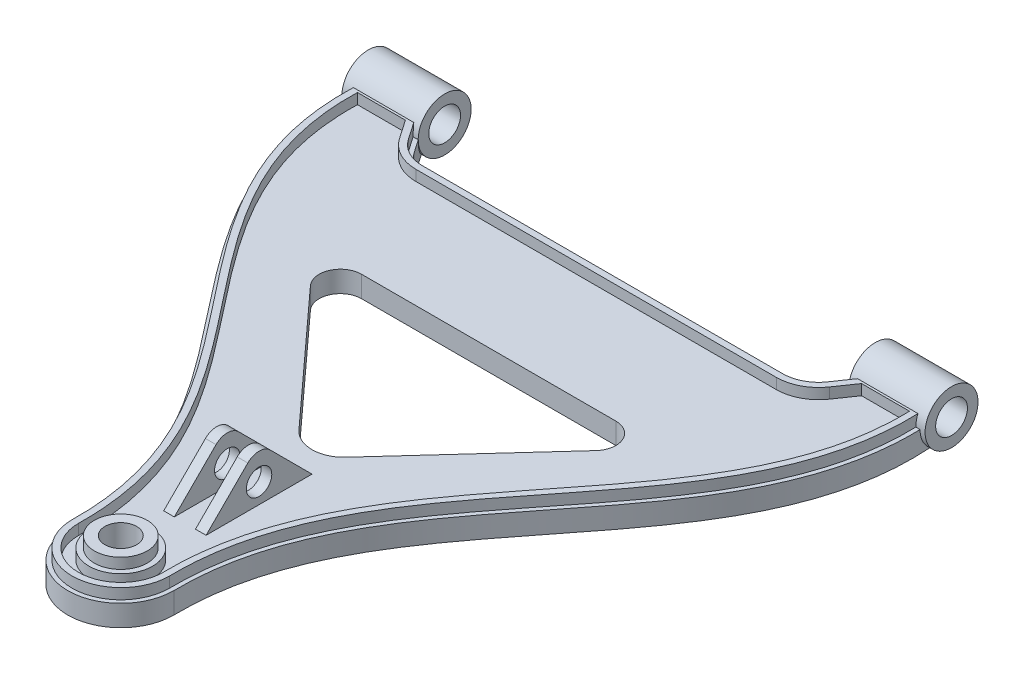
from build123d import *

# Parameters (mm, degrees)
SALIENTE_EXTRUIR1_DEPTH = 5
CROQUIS6_R              = 6
SALIENTE_EXTRUIR2_DEPTH = 5
EXTRUIR_L_MINA1_DEPTH   = 5
CROQUIS9_R              = 12.5
CROQUIS9_R_2            = 7.5
SALIENTE_EXTRUIR3_DEPTH = 18
CROQUIS10_R             = 15
SALIENTE_EXTRUIR4_DEPTH = 5
CROQUIS10_3_R           = 12.5
SALIENTE_EXTRUIR5_DEPTH = 10
CROQUIS11_R             = 7.5
CORTAR_EXTRUIR1_DEPTH   = 20


# Read off the part's stored shape, not the designer's step: Extruir-Lámina1
with BuildPart() as part:
    # Croquis1 → Saliente-Extruir1 (new, symmetric)
    with BuildSketch(Plane(origin=(0, 0, 0), x_dir=(1, 0, 0), z_dir=(0, 1, 0))):
        with BuildLine():
            Line((-135, 131.926889983), (-105, 131.926889983))
            Line((-105, 131.926889983), (-97.355197186, 120.822380101))
            ThreePointArc((-97.355197186, 120.822380101), (-91.978989417, 116.050643627), (-85, 114.328207662))
            Line((-85, 114.328207662), (85, 114.328207662))
            ThreePointArc((85, 114.328207662), (91.978989417, 116.050643627), (97.355197186, 120.822380101))
            Line((97.355197186, 120.822380101), (105, 131.926889983))
            Line((105, 131.926889983), (135, 131.926889983))
            add(Edge.make_bspline(
                [(135, 131.926889983), (141.952707227, 30.351328575), (23.130947771, -13.752661754), (25, -115)],
                knots=[0, 0, 0, 0, 1, 1, 1, 1], degree=3))
            ThreePointArc((25, -115), (0, -140), (-25, -115))
            add(Edge.make_bspline(
                [(-135, 131.926889983), (-141.952707227, 30.351328575), (-23.130947771, -13.752661754), (-25, -115)],
                knots=[0, 0, 0, 0, 1, 1, 1, 1], degree=3))
        make_face()
        with BuildLine():
            Line((-67.388374008, 41.875089785), (-11.082561012, -19.857874005))
            ThreePointArc((-11.082561012, -19.857874005), (0, -24.749617904), (11.082561012, -19.857874005))
            Line((11.082561012, -19.857874005), (67.388374008, 41.875089785))
            ThreePointArc((67.388374008, 41.875089785), (69.148452711, 52.651972876), (60, 58.613927185))
            Line((60, 58.613927185), (-60, 58.613927185))
            ThreePointArc((-60, 58.613927185), (-69.148452711, 52.651972876), (-67.388374008, 41.875089785))
        make_face(mode=Mode.SUBTRACT)
    extrude(amount=SALIENTE_EXTRUIR1_DEPTH, both=True)

    # Croquis6 → Saliente-Extruir2 (add)
    with BuildSketch(Plane(origin=(5, 0, 0), x_dir=(0, 0, -1), z_dir=(1, 0, 0))):
        with BuildLine():
            Line((-34.749617904, 5), (-54.446317045, 24.696699141))
            ThreePointArc((-54.446317045, 24.696699141), (-59.749617904, 26.893398282), (-65.052918763, 24.696699141))
            Line((-65.052918763, 24.696699141), (-84.749617904, 5))
            Line((-84.749617904, 5), (-34.749617904, 5))
        make_face()
        with Locations((-59.749617904, 14.393398282)):
            Circle(CROQUIS6_R, mode=Mode.SUBTRACT)
    saliente_extruir2 = extrude(amount=SALIENTE_EXTRUIR2_DEPTH)

    # Simetría1: Saliente-Extruir2 across plane
    add(saliente_extruir2.mirror(Plane(origin=(0, 0, 0), x_dir=(0, 0, 1), z_dir=(1, 0, 0))))

    # Extruir-Lámina1 outline → Extruir-Lámina1 (add)
    with BuildSketch(Plane(origin=(0, 5, 0), x_dir=(1, 0, 0), z_dir=(0, 1, 0))):
        with BuildLine():
            Line((-106.051245454, 129.926889983), (-133.152785768, 129.926889983))
            add(Edge.make_bspline(
                [(-133.152785768, 129.926889983), (-133.174268661, 129.206657548), (-133.195751554, 128.486425113), (-133.238717339, 127.045960243), (-133.260373261, 126.325704896), (-133.29971078, 124.168332797), (-133.301445055, 119.863777053), (-133.071902544, 115.589846855), (-132.303121335, 107.08299626), (-131.375659828, 101.466708751), (-129.377010697, 93.122716596), (-128.609455105, 90.354805161), (-127.310297322, 86.222512835), (-126.853085806, 84.849889782), (-125.898422992, 82.13221094), (-125.400190812, 80.784491049), (-122.810267538, 74.098434679), (-120.42291954, 68.917392178), (-115.158069426, 58.816076633), (-112.280987066, 53.895580273), (-107.696886081, 46.657669825), (-106.124147998, 44.268816441), (-102.905009703, 39.53029905), (-101.257661562, 37.179322504), (-92.887901697, 25.518907347), (-85.780126078, 16.499131041), (-71.58045013, -1.552311855), (-64.485262059, -10.58151599), (-56.133776454, -22.255618212), (-54.489378689, -24.60983677), (-51.266448327, -29.367605618), (-49.686457, -31.773531765), (-45.084200101, -39.052900232), (-42.196352007, -43.992840655), (-36.899381702, -54.103765632), (-34.490320683, -59.274779718), (-31.324385536, -67.247350119), (-30.343694104, -69.940887052), (-28.995690401, -74.040571223), (-28.566659059, -75.417806864), (-27.752342999, -78.1897194), (-27.36871345, -79.578876355), (-25.569409892, -86.540828042), (-24.511463015, -92.162286021), (-23.173842405, -103.511074009), (-22.89542751, -109.238575264), (-22.999992819, -115.018175056)],
                knots=[0, 0, 0, 0, 0.0078125, 0.0078125, 0.015625, 0.015625, 0.03125, 0.0625, 0.0625, 0.125, 0.125, 0.15625, 0.15625, 0.171875, 0.171875, 0.1875, 0.1875, 0.25, 0.25, 0.3125, 0.3125, 0.34375, 0.34375, 0.375, 0.375, 0.5, 0.5, 0.625, 0.625, 0.65625, 0.65625, 0.6875, 0.6875, 0.75, 0.75, 0.8125, 0.8125, 0.84375, 0.84375, 0.859375, 0.859375, 0.875, 0.875, 0.9375, 0.9375, 1, 1, 1, 1], degree=3))
            ThreePointArc((-22.999992819, -115.018175056), (0, -138), (22.999992819, -115.018175056))
            add(Edge.make_bspline(
                [(22.999992819, -115.018175056), (22.895226578, -109.227469196), (23.175119897, -103.499493799), (24.510635399, -92.170049231), (25.564939035, -86.568365032), (27.708902858, -78.257572863), (28.51704955, -75.502555539), (29.865517568, -71.392248939), (30.338548889, -70.023401781), (31.323606713, -67.307934522), (33.883396821, -60.573683364), (36.902914511, -54.096952925), (44.842899172, -38.941069981), (51.05964732, -29.354413219), (59.399269025, -17.689647357), (61.096404781, -15.371876329), (64.528507919, -10.767382329), (66.263972325, -8.479913942), (71.509332424, -1.647173505), (75.058209766, 2.868422579), (82.159416645, 11.896986658), (85.711763576, 16.409941411), (92.71853999, 25.510393556), (96.172818384, 30.098005967), (101.199601756, 37.097144589), (102.850583686, 39.451755912), (106.077537799, 44.198688655), (107.653878795, 46.591420768), (112.247661329, 53.839778233), (115.129622576, 58.765689131), (120.401963318, 68.872537636), (122.791888775, 74.053710792), (125.900918311, 82.072340278), (126.85794185, 84.78636685), (128.595390264, 90.306037259), (129.365828105, 93.080127996), (131.371298301, 101.438867894), (132.300684578, 107.06336018), (133.071299421, 115.579637461), (133.224668995, 118.431600887), (133.300279497, 122.729249291), (133.29974204, 124.165082676), (133.260423161, 126.323746033), (133.238764128, 127.044391606), (133.195774948, 128.485640795), (133.174280358, 129.206265389), (133.152785768, 129.926889983)],
                knots=[0, 0, 0, 0, 0.0625, 0.0625, 0.125, 0.125, 0.15625, 0.15625, 0.171875, 0.171875, 0.1875, 0.25, 0.25, 0.375, 0.375, 0.40625, 0.40625, 0.4375, 0.4375, 0.5, 0.5, 0.5625, 0.5625, 0.625, 0.625, 0.65625, 0.65625, 0.6875, 0.6875, 0.75, 0.75, 0.8125, 0.8125, 0.84375, 0.84375, 0.875, 0.875, 0.9375, 0.9375, 0.96875, 0.96875, 0.984375, 0.984375, 0.9921875, 0.9921875, 1, 1, 1, 1], degree=3))
            Line((133.152785768, 129.926889983), (106.051245454, 129.926889983))
            Line((106.051245454, 129.926889983), (99.00255681, 119.688269759))
            ThreePointArc((99.00255681, 119.688269759), (92.90952134, 114.280301755), (85, 112.328207662))
            Line((85, 112.328207662), (-85, 112.328207662))
            ThreePointArc((-85, 112.328207662), (-92.90952134, 114.280301755), (-99.00255681, 119.688269759))
            Line((-99.00255681, 119.688269759), (-106.051245454, 129.926889983))
        make_face()
        with BuildLine():
            add(Edge.make_bspline(
                [(-130.240934691, 126.926889983), (-130.411547803, 121.206938866), (-130.167660454, 115.547790898), (-128.847873599, 104.35154298), (-127.771663621, 98.814488573), (-125.924626652, 91.966775959), (-125.530222733, 90.600900181), (-124.692269656, 87.876357749), (-124.247843704, 86.515308788), (-122.852183388, 82.470259757), (-121.837255643, 79.818705121), (-118.567479133, 71.984263185), (-116.088003331, 66.921402163), (-110.672433719, 57.039667488), (-107.736270132, 52.220831119), (-103.088325832, 45.122793633), (-101.498316815, 42.778525535), (-98.252555912, 38.12511811), (-96.597218478, 35.816635505), (-88.212586529, 24.366109238), (-81.147647458, 15.472894286), (-67.116887318, -2.387674605), (-60.14620433, -11.351391892), (-51.980786937, -22.965887821), (-50.3752326, -25.30937845), (-47.232310585, -30.047362451), (-45.695210028, -32.441712267), (-41.22621426, -39.683394316), (-38.430313516, -44.598820237), (-33.314610216, -54.657139194), (-30.994773138, -59.800015737), (-27.952783748, -67.72348367), (-27.011738958, -70.399494027), (-25.719660825, -74.470598268), (-25.308321792, -75.839168342), (-24.529959844, -78.586079762), (-24.163389081, -79.962558454), (-22.44464198, -86.860207974), (-21.435659553, -92.427263793), (-20.161720093, -103.660851552), (-19.89654276, -109.327354037), (-19.999953481, -115.043136709)],
                knots=[0, 0, 0, 0, 0.0625, 0.0625, 0.125, 0.125, 0.140625, 0.140625, 0.15625, 0.15625, 0.1875, 0.1875, 0.25, 0.25, 0.3125, 0.3125, 0.34375, 0.34375, 0.375, 0.375, 0.5, 0.5, 0.625, 0.625, 0.65625, 0.65625, 0.6875, 0.6875, 0.75, 0.75, 0.8125, 0.8125, 0.84375, 0.84375, 0.859375, 0.859375, 0.875, 0.875, 0.9375, 0.9375, 1, 1, 1, 1], degree=3))
            Line((-130.240934691, 126.926889983), (-107.628113635, 126.926889983))
            Line((-107.628113635, 126.926889983), (-101.473596247, 117.987104247))
            ThreePointArc((-101.473596247, 117.987104247), (-94.305319223, 111.624788948), (-85, 109.328207662))
            Line((-85, 109.328207662), (85, 109.328207662))
            ThreePointArc((85, 109.328207662), (94.305319223, 111.624788948), (101.473596247, 117.987104247))
            Line((101.473596247, 117.987104247), (107.628113635, 126.926889983))
            Line((107.628113635, 126.926889983), (130.240934691, 126.926889983))
            add(Edge.make_bspline(
                [(19.999953481, -115.043136709), (19.896427023, -109.32095693), (20.162471748, -103.656694634), (21.433484981, -92.443970754), (22.438644162, -86.895539052), (24.487167219, -78.657640706), (25.259980416, -75.925774614), (26.550800135, -71.848599206), (27.003831738, -70.490678553), (27.947611297, -67.796645784), (28.438448915, -66.459946369), (30.982768295, -59.825525168), (33.30643755, -54.67491864), (40.970707434, -39.600575574), (47.003894339, -30.053947563), (55.153034009, -18.451527139), (56.813969399, -16.146756985), (60.17676541, -11.571661263), (65.284475951, -4.757529312), (70.527406248, 1.95332666), (77.541655616, 10.883052022), (81.060774666, 15.338753839), (88.025039956, 24.30665524), (91.470366291, 28.818717273), (96.504855219, 35.688773254), (98.16144298, 37.996989622), (101.405963711, 42.643758601), (102.99490041, 44.983639174), (107.638239543, 52.064402242), (110.569379356, 56.866302948), (118.67461083, 71.612676057), (123.164034637, 81.896076903), (126.554911876, 94.28650979), (126.908556251, 95.67466944), (127.567304158, 98.475017725), (127.87138094, 99.883309895), (128.701614509, 104.108909856), (129.147967615, 106.936415177), (130.164965006, 115.450310911), (130.412704392, 121.16816323), (130.240934691, 126.926889983)],
                knots=[0, 0, 0, 0, 0.0625, 0.0625, 0.125, 0.125, 0.15625, 0.15625, 0.171875, 0.171875, 0.1875, 0.1875, 0.25, 0.25, 0.375, 0.375, 0.40625, 0.40625, 0.4375, 0.5, 0.5, 0.5625, 0.5625, 0.625, 0.625, 0.65625, 0.65625, 0.6875, 0.6875, 0.75, 0.75, 0.875, 0.875, 0.890625, 0.890625, 0.90625, 0.90625, 0.9375, 0.9375, 1, 1, 1, 1], degree=3))
            ThreePointArc((19.999953481, -115.043136709), (0, -135), (-19.999953481, -115.043136709))
        make_face(mode=Mode.SUBTRACT)
    extrude(amount=EXTRUIR_L_MINA1_DEPTH)

    # Croquis9 → Saliente-Extruir3 (add, symmetric)
    with BuildSketch(Plane(origin=(-119.602015611, 10, -129.926889983), x_dir=(0, 0, 1), z_dir=(-1, 0, 0))):
        with Locations((-9.5, -5)):
            Circle(CROQUIS9_R)
        with Locations((-9.5, -5)):
            Circle(CROQUIS9_R_2, mode=Mode.SUBTRACT)
    saliente_extruir3 = extrude(amount=SALIENTE_EXTRUIR3_DEPTH, both=True)

    # Simetría2: Saliente-Extruir3 across plane
    add(saliente_extruir3.mirror(Plane(origin=(0, 0, 0), x_dir=(0, 0, 1), z_dir=(1, 0, 0))))

    # Croquis10 → Saliente-Extruir4 (add)
    with BuildSketch(Plane(origin=(0, 5, 0), x_dir=(1, 0, 0), z_dir=(0, 1, 0))):
        with Locations(Location((0, -115, 0), (0, 0, 90))):
            Circle(CROQUIS10_R)
    extrude(amount=SALIENTE_EXTRUIR4_DEPTH)

    # Croquis10<3> → Saliente-Extruir5 (add)
    with BuildSketch(Plane(origin=(0, 5, 0), x_dir=(1, 0, 0), z_dir=(0, 1, 0))):
        with Locations(Location((0, -115, 0), (0, 0, 270))):
            Circle(CROQUIS10_3_R)
    extrude(amount=SALIENTE_EXTRUIR5_DEPTH)

    # Croquis11 → Cortar-Extruir1 (cut)
    with BuildSketch(Plane(origin=(0, 15, 0), x_dir=(1, 0, 0), z_dir=(0, 1, 0))):
        with Locations(Location((0, -115, 0), (0, 0, 270))):
            Circle(CROQUIS11_R)
    extrude(amount=-CORTAR_EXTRUIR1_DEPTH, mode=Mode.SUBTRACT)


solid = part.part
